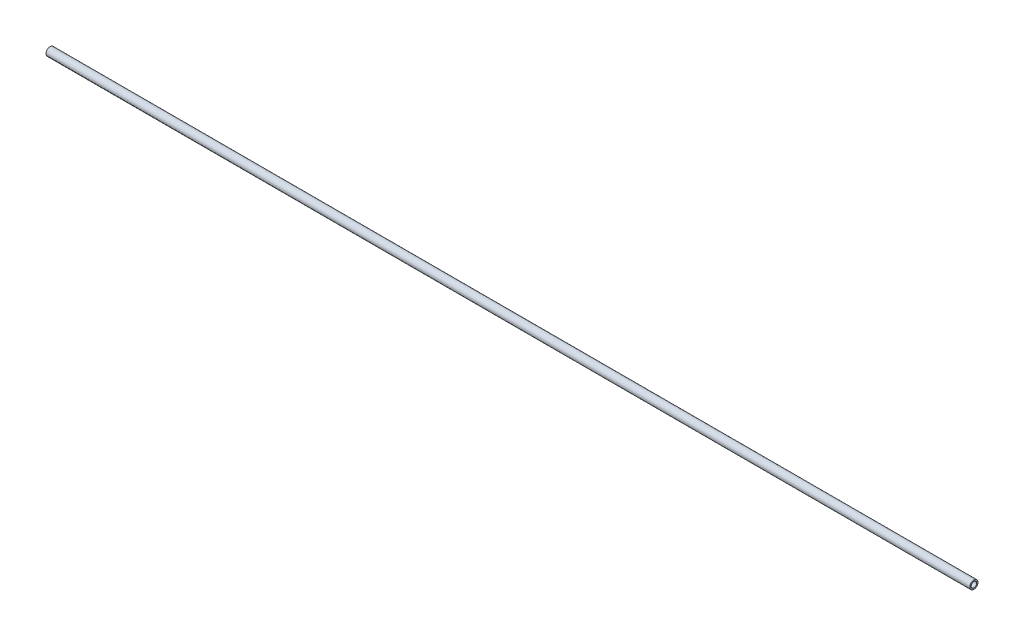
from build123d import *

# Parameters (mm, degrees)
SKETCH1_R           = 3
SKETCH1_R_2         = 2
BOSS_EXTRUDE1_DEPTH = 337.5


with BuildPart() as part:
    # Sketch1 → Boss-Extrude1 (new, symmetric)
    with BuildSketch(Plane(origin=(0, 0, 0), x_dir=(0, 0, -1), z_dir=(1, 0, 0))):
        Circle(SKETCH1_R)
        Circle(SKETCH1_R_2, mode=Mode.SUBTRACT)
    extrude(amount=BOSS_EXTRUDE1_DEPTH, both=True)


solid = part.part
